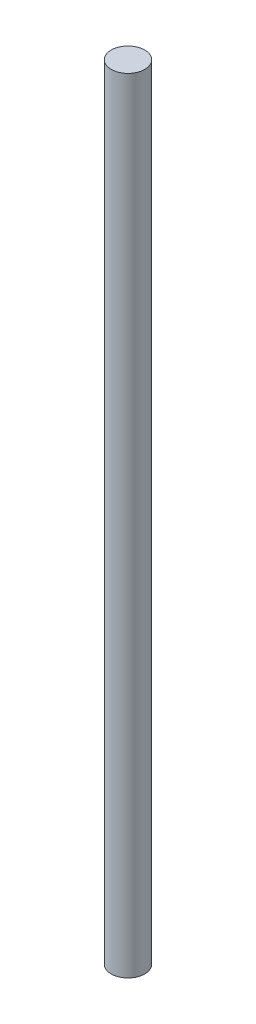
from build123d import *

# Parameters (mm, degrees)
SKETCH1_R           = 3
BOSS_EXTRUDE1_DEPTH = 140


with BuildPart() as part:
    # Sketch1 → Boss-Extrude1 (new body)
    with BuildSketch(Plane(origin=(0, 0, 0), x_dir=(1, 0, 0), z_dir=(0, 1, 0))):
        Circle(SKETCH1_R)
    extrude(amount=BOSS_EXTRUDE1_DEPTH)


solid = part.part
